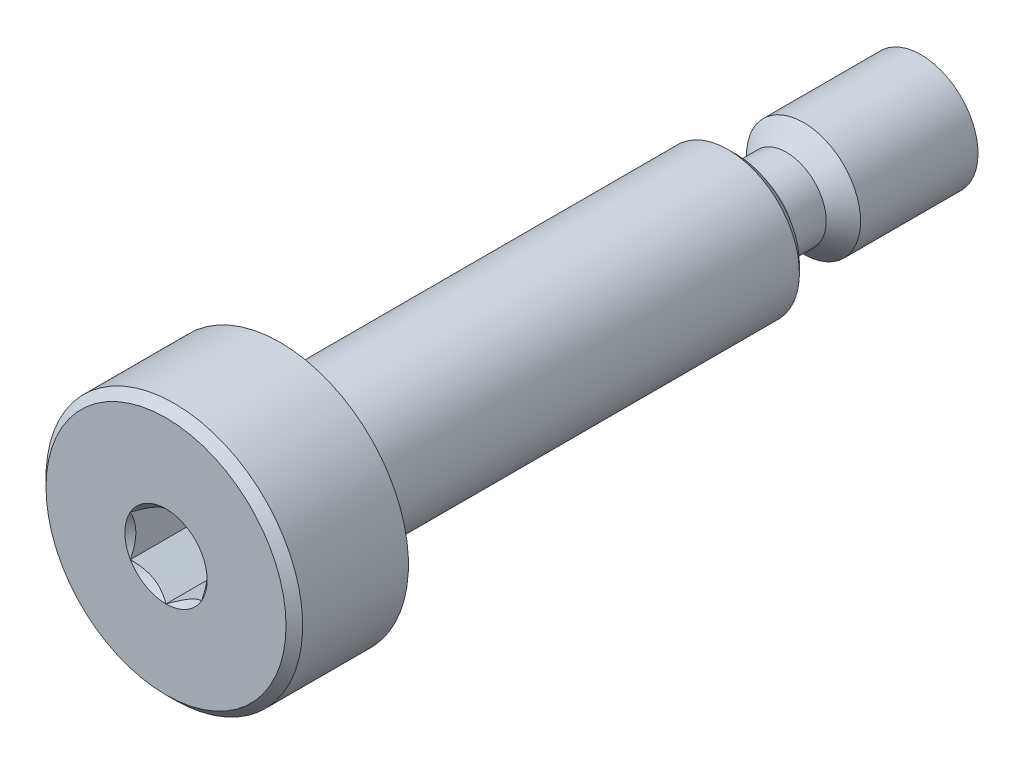
from build123d import *

# Parameters (mm, degrees)
SKETCH4_W           = 0.6
SKETCH4_H           = 0.6
CHAMFER1_SIZE       = 0.1625
CHAMFER2_SIZE       = 0.5
CHAMFER3_SIZE       = 0.2925
CUT_EXTRUDE1_DEPTH  = 2
SPLIT2_START        = -5.2075
SPLIT2_OUTLINE_R    = 4.5
SPLIT2_DEPTH        = 19.7075
SPLIT2_START_2      = 12.5
SPLIT2_3_DEPTH      = 2
SPLIT2_10_OUTLINE_R = 2.5
SPLIT2_10_DEPTH     = 14.945
SKETCH15_R          = 2.571420452
CUT_EXTRUDE4_DEPTH  = 2.53


with BuildPart() as part:
    # Sketch3 → Revolve1 (revolve)
    with BuildSketch(Plane(origin=(0, 0, 0), x_dir=(0, 0, -1), z_dir=(1, 0, 0))):
        Polygon((-14.5, 4.5), (-10.5, 4.5), (-10.5, 2.5), (5.5, 2.5), (5.5, 2), (14.5, 2), (14.5, 0), (-14.5, 0), align=None)
    revolve(axis=Axis((0, 0, -14.5), (0, 0, 1)))

    # Sketch4 → Cut-Revolve1 (revolve, cut)
    with BuildSketch(Plane(origin=(0, 0, 0), x_dir=(0, 0, -1), z_dir=(1, 0, 0))):
        with Locations((-10.2, 2.2)):
            Rectangle(SKETCH4_W, SKETCH4_H)
    revolve(axis=Axis((0, 0, -14.5), (0, 0, 1)), mode=Mode.SUBTRACT)

    # Chamfer1
    chamfer1_edges = [part.edges().sort_by_distance(p)[0] for p in [
        (0, -1.9, 9.9),
        (0, -2.5, 9.9),
    ]]
    chamfer(chamfer1_edges, length=CHAMFER1_SIZE)

    # Sketch6 → Cut-Revolve2 (revolve, cut)
    with BuildSketch(Plane(origin=(0, 0, 0), x_dir=(0, 0, -1), z_dir=(1, 0, 0))):
        with BuildLine():
            Line((5.5, 2.5), (8.352, 2.5))
            Line((8.352, 2.5), (7.25, 1.398))
            Line((7.25, 1.398), (6.102, 1.398))
            ThreePointArc((6.102, 1.398), (5.676321718, 1.574321718), (5.5, 2))
            Line((5.5, 2), (5.5, 2.5))
        make_face()
    revolve(axis=Axis((0, 0, -14.5), (0, 0, 1)), mode=Mode.SUBTRACT)

    # Chamfer2
    chamfer2_edges = [part.edges().sort_by_distance(p)[0] for p in [
        (0, -2, -14.5),
    ]]
    chamfer(chamfer2_edges, length=CHAMFER2_SIZE)

    # Chamfer3
    chamfer3_edges = [part.edges().sort_by_distance(p)[0] for p in [
        (0, -2.5, -5.5),
        (0, -4.5, 14.5),
    ]]
    chamfer(chamfer3_edges, length=CHAMFER3_SIZE)

    # Sketch8 → Cut-Extrude1 (cut)
    with BuildSketch(Plane.XY.offset(14.5)):
        Polygon((1.25, 0.721687836), (0, 1.443375673), (-1.25, 0.721687836), (-1.25, -0.721687836), (0, -1.443375673), (1.25, -0.721687836), align=None)
    extrude(amount=-CUT_EXTRUDE1_DEPTH, mode=Mode.SUBTRACT)

    # Cut-Extrude2 cone 1 section (through the dimple's axis) → Cut-Extrude2 (revolve, cut)
    with BuildSketch(Plane(origin=(0, 0, 14.5), x_dir=(0, -1, 0), z_dir=(1, 0, 0))):
        Polygon((0, 0), (1.443375673, 0), (0, 1.443375673), align=None)
    revolve(axis=Axis((0, 0, 14.5), (0, 0, -1)), mode=Mode.SUBTRACT)

    # Split2: read off the stored shape, not the designer's step
    # Split2 outline → Split2 (cut)
    with BuildSketch(Plane.XY.offset(SPLIT2_START)):
        Circle(SPLIT2_OUTLINE_R)
    extrude(amount=SPLIT2_DEPTH, mode=Mode.SUBTRACT)

    # Sketch15 → Cut-Extrude4 (cut)
    with BuildSketch(Plane(origin=(0, 0, -14.5), x_dir=(-1, 0, 0), z_dir=(0, 0, -1))):
        Circle(SKETCH15_R)
    extrude(amount=-CUT_EXTRUDE4_DEPTH, mode=Mode.SUBTRACT)


with BuildPart() as body_2:
    # Split2 2 outline → Split2 2 (revolve)
    with BuildSketch(Plane.XZ):
        Polygon((0, 14.500000022), (0, 9.7375), (2.5, 9.7375), (2.3375, 9.9), (2.0625, 9.9), (1.9, 10.0625), (1.9, 10.5), (4.5, 10.5), (4.5, 14.2075), (4.2075, 14.5), (1.443375689, 14.500000017), align=None)
    revolve(axis=Axis((0, 0, 0), (0, 0, 1)))

    # Split2 3 outline → Split2 3 (cut)
    with BuildSketch(Plane.XY.offset(SPLIT2_START_2)):
        Polygon((1.25, -0.721687836), (1.25, 0.721687836), (0, 1.443375673), (-1.25, 0.721687836), (-1.25, -0.721687836), (0, -1.443375673), align=None)
    extrude(amount=SPLIT2_3_DEPTH, mode=Mode.SUBTRACT)

    # Split2 4: loft between two sections, ruled curve by curve
    split2_4_from = [
        Edge.make_three_point_arc((1.08239615, 0.624921709, 14.306467745), (0.624921709, 1.08239615, 14.306467745), (0, 1.249843418, 14.306467745)),
        Edge.make_line((0, 1.249843418, 14.306467745), (1.08239615, 0.624921709, 14.306467745)),
    ]
    split2_4_to = [
        Edge.make_three_point_arc((1.250000029, 0.721687853, 14.500000033), (0.721687853, 1.250000029, 14.500000033), (0, 1.443375706, 14.500000033)),
        Edge.make_line((0, 1.443375706, 14.500000033), (1.250000029, 0.721687853, 14.500000033)),
    ]
    split2_4 = Solid(Shell([*[Face.make_surface_from_curves(split2_4_from[k], split2_4_to[k]) for k in range(2)], Face(Wire(split2_4_from)), Face(Wire(split2_4_to))]))
    add(split2_4, mode=Mode.SUBTRACT)

    # Split2 5: loft between two sections, ruled curve by curve
    split2_5_from = [
        Edge.make_three_point_arc((0, 1.249843418, 14.306467745), (-0.624921709, 1.08239615, 14.306467745), (-1.08239615, 0.624921709, 14.306467745)),
        Edge.make_line((-1.08239615, 0.624921709, 14.306467745), (0, 1.249843418, 14.306467745)),
    ]
    split2_5_to = [
        Edge.make_three_point_arc((0, 1.443375706, 14.500000033), (-0.721687853, 1.250000029, 14.500000033), (-1.250000029, 0.721687853, 14.500000033)),
        Edge.make_line((-1.250000029, 0.721687853, 14.500000033), (0, 1.443375706, 14.500000033)),
    ]
    split2_5 = Solid(Shell([*[Face.make_surface_from_curves(split2_5_from[k], split2_5_to[k]) for k in range(2)], Face(Wire(split2_5_from)), Face(Wire(split2_5_to))]))
    add(split2_5, mode=Mode.SUBTRACT)

    # Split2 6: loft between two sections, ruled curve by curve
    split2_6_from = [
        Edge.make_three_point_arc((-1.082395782, 0.624921515, 14.306467329), (-1.249843002, -4.66e-07, 14.306467329), (-1.082395316, -0.624922322, 14.306467329)),
        Edge.make_line((-1.082395316, -0.624922322, 14.306467329), (-1.082395782, 0.624921515, 14.306467329)),
    ]
    split2_6_to = [
        Edge.make_three_point_arc((-1.249999991, 0.721687853, 14.5), (-1.443375673, -5.38e-07, 14.5), (-1.249999452, -0.721688785, 14.5)),
        Edge.make_line((-1.249999452, -0.721688785, 14.5), (-1.249999991, 0.721687853, 14.5)),
    ]
    split2_6 = Solid(Shell([*[Face.make_surface_from_curves(split2_6_from[k], split2_6_to[k]) for k in range(2)], Face(Wire(split2_6_from)), Face(Wire(split2_6_to))]))
    add(split2_6, mode=Mode.SUBTRACT)

    # Split2 7: loft between two sections, ruled curve by curve
    split2_7_from = [
        Edge.make_three_point_arc((-1.08239615, -0.624921709, 14.306467745), (-0.624921709, -1.08239615, 14.306467745), (0, -1.249843418, 14.306467745)),
        Edge.make_line((0, -1.249843418, 14.306467745), (-1.08239615, -0.624921709, 14.306467745)),
    ]
    split2_7_to = [
        Edge.make_three_point_arc((-1.250000029, -0.721687853, 14.500000033), (-0.721687853, -1.250000029, 14.500000033), (0, -1.443375706, 14.500000033)),
        Edge.make_line((0, -1.443375706, 14.500000033), (-1.250000029, -0.721687853, 14.500000033)),
    ]
    split2_7 = Solid(Shell([*[Face.make_surface_from_curves(split2_7_from[k], split2_7_to[k]) for k in range(2)], Face(Wire(split2_7_from)), Face(Wire(split2_7_to))]))
    add(split2_7, mode=Mode.SUBTRACT)

    # Split2 8: loft between two sections, ruled curve by curve
    split2_8_from = [
        Edge.make_three_point_arc((0, -1.249843418, 14.306467745), (0.624921709, -1.08239615, 14.306467745), (1.08239615, -0.624921709, 14.306467745)),
        Edge.make_line((1.08239615, -0.624921709, 14.306467745), (0, -1.249843418, 14.306467745)),
    ]
    split2_8_to = [
        Edge.make_three_point_arc((0, -1.443375706, 14.500000033), (0.721687853, -1.250000029, 14.500000033), (1.250000029, -0.721687853, 14.500000033)),
        Edge.make_line((1.250000029, -0.721687853, 14.500000033), (0, -1.443375706, 14.500000033)),
    ]
    split2_8 = Solid(Shell([*[Face.make_surface_from_curves(split2_8_from[k], split2_8_to[k]) for k in range(2)], Face(Wire(split2_8_from)), Face(Wire(split2_8_to))]))
    add(split2_8, mode=Mode.SUBTRACT)

    # Split2 9: loft between two sections, ruled curve by curve
    split2_9_from = [
        Edge.make_three_point_arc((1.082395316, -0.624922322, 14.306467329), (1.249843002, -4.66e-07, 14.306467329), (1.082395782, 0.624921515, 14.306467329)),
        Edge.make_line((1.082395782, 0.624921515, 14.306467329), (1.082395316, -0.624922322, 14.306467329)),
    ]
    split2_9_to = [
        Edge.make_three_point_arc((1.249999452, -0.721688785, 14.5), (1.443375673, -5.38e-07, 14.5), (1.249999991, 0.721687853, 14.5)),
        Edge.make_line((1.249999991, 0.721687853, 14.5), (1.249999452, -0.721688785, 14.5)),
    ]
    split2_9 = Solid(Shell([*[Face.make_surface_from_curves(split2_9_from[k], split2_9_to[k]) for k in range(2)], Face(Wire(split2_9_from)), Face(Wire(split2_9_to))]))
    add(split2_9, mode=Mode.SUBTRACT)


with BuildPart() as body_3:
    # Split2 10 outline → Split2 10 (new body)
    with BuildSketch(Plane.XY.offset(SPLIT2_START)):
        Circle(SPLIT2_10_OUTLINE_R)
    extrude(amount=SPLIT2_10_DEPTH)


solid = Compound([part.part, body_2.part, body_3.part])
